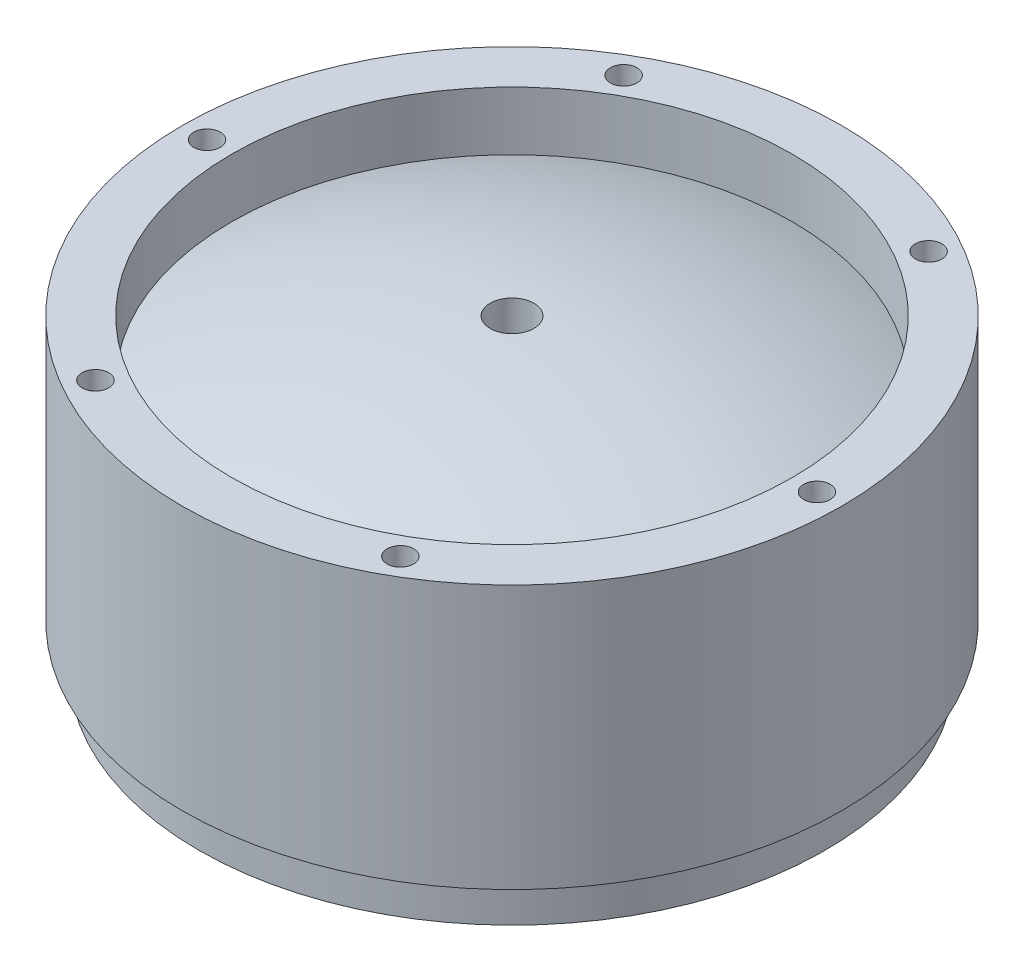
from build123d import *

# Parameters (mm, degrees)
CIRPATTERN1_COUNT = 6


with BuildPart() as part:
    # Sketch1 → Revolve2 (revolve)
    with BuildSketch(Plane.XY):
        with BuildLine():
            Line((-63.5, 58.983087105), (-63.5, 8.183087105))
            Line((-63.5, 8.183087105), (-60.325, 6.35))
            Line((-60.325, 6.35), (-60.325, 0))
            Line((-60.325, 0), (-57.94375, 0))
            Line((-57.94375, 0), (-57.94375, 6.35))
            Line((-57.94375, 6.35), (-54.284555142, 27.102325272))
            ThreePointArc((-54.284555142, 27.102325272), (-50.748303624, 38.157916981), (-41.452417814, 45.109009691))
            ThreePointArc((-41.452417814, 45.109009691), (-23.092477169, 49.947342032), (-4.2164, 51.994435356))
            Line((-4.2164, 51.994435356), (-4.2164, 58.983087105))
            ThreePointArc((-4.2164, 58.983087105), (-29.637900729, 55.730337873), (-53.975, 47.696741172))
            Line((-53.975, 47.696741172), (-53.975, 58.983087105))
            Line((-53.975, 58.983087105), (-63.5, 58.983087105))
        make_face()
    revolve(axis=Axis((0, 127.060987048, 0), (0, -1, 0)))

    # Sketch11 → 1/4-20 Tapped Hole1 (revolve, cut)
    with BuildSketch(Plane(origin=(-58.7375, 58.983087105, 0), x_dir=(0, 0, 1), z_dir=(1, 0, 0))):
        Polygon((0, 0), (0, 14.233816902), (2.5527, 12.7), (2.5527, 0), align=None)
    f_1_4_20_tapped_hole1 = revolve(axis=Axis((-58.7375, 65.333087105, 0), (0, -1, 0)), mode=Mode.SUBTRACT)

    # CirPattern1: 1/4-20 Tapped Hole1 ×6 about axis
    cirpattern1_axis = Axis((0, 127.060987048, 0), (0, -1, 0))
    for i in range(1, CIRPATTERN1_COUNT):
        add(f_1_4_20_tapped_hole1.rotate(cirpattern1_axis, i * 360 / CIRPATTERN1_COUNT), mode=Mode.SUBTRACT)


solid = part.part
